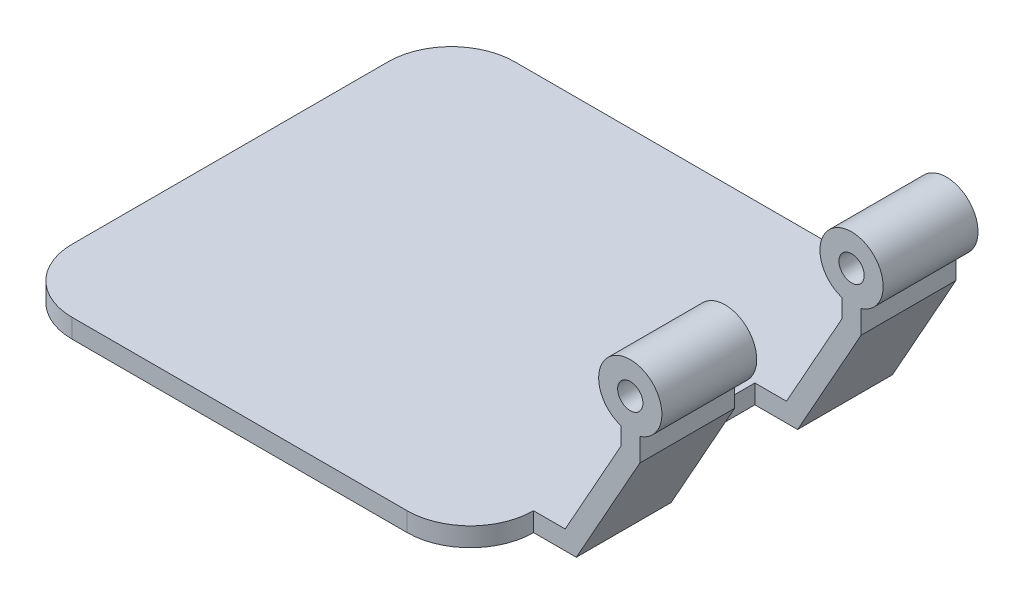
from build123d import *

# Parameters (mm, degrees)
SKETCH1_R               = 5
BOSS_EXTRUDE1_DEPTH     = 50
SKETCH2_R               = 2
CUT_EXTRUDE1_DEPTH      = 113.087037288
CUT_EXTRUDE3_DEPTH      = 10
CUT_EXTRUDE3_DEPTH_BACK = 10
SKETCH7_W               = 20
SKETCH7_H               = 39.987182744
BOSS_EXTRUDE2_REACH     = 114.087
CUT_EXTRUDE4_REACH      = 114.087
SKETCH9_W               = 20
SKETCH9_H               = 10.896319728
CUT_EXTRUDE6_REACH      = 114.087
SKETCH11_W              = 5
SKETCH11_H              = 3
SKETCH12_W              = 73
SKETCH12_H              = 70
BOSS_EXTRUDE3_DEPTH     = 3
SKETCH13_W              = 6.758772051
SKETCH13_H              = 20
CUT_EXTRUDE7_DEPTH      = 117.122297969
FILLET1_R               = 10


with BuildPart() as part:
    # Sketch1 → Boss-Extrude1 (new body)
    with BuildSketch(Plane.XY):
        with Locations((90.291740814, 26.352640412)):
            Circle(SKETCH1_R)
        Polygon((0, 3), (0, 0), (81.758772051, 0), (91.791740814, 17.924366601), (91.791740814, 23.706854983), (88.791740814, 23.706854983), (88.791740814, 18.706854983), (80, 3), align=None)
    extrude(amount=BOSS_EXTRUDE1_DEPTH)

    # Sketch2 → Cut-Extrude1 (cut, through all)
    with BuildSketch(Plane.XY):
        with Locations((90.291740814, 26.352640412)):
            Circle(SKETCH2_R)
    extrude(amount=CUT_EXTRUDE1_DEPTH, mode=Mode.SUBTRACT)

    # Sketch7 → Cut-Extrude3 (cut, two sides: drawn at the far end of the back side and taken through both)
    with BuildSketch(Plane(origin=(62.254079791, -34.846042362, 0), x_dir=(0, 0, -1), z_dir=(0.8726030546274219, -0.4884300452008377, 0)).offset(-CUT_EXTRUDE3_DEPTH_BACK)):
        with Locations((-25, 59.927032101)):
            Rectangle(SKETCH7_W, SKETCH7_H)
    extrude(amount=CUT_EXTRUDE3_DEPTH + CUT_EXTRUDE3_DEPTH_BACK, mode=Mode.SUBTRACT)

    # Sketch8 → Boss-Extrude2 (add, up to next)
    with BuildSketch(Plane.XY, mode=Mode.PRIVATE) as boss_extrude2_sk1:
        Polygon((66.951015515, 3), (66.951015515, 0), (81.758772051, 0), (79.25400484, 1.667244856), (80, 3), align=None)
    boss_extrude2_tool1 = extrude(boss_extrude2_sk1.sketch, amount=BOSS_EXTRUDE2_REACH, mode=Mode.PRIVATE) - part.part
    add(boss_extrude2_tool1.solids().sort_by_distance((73.552437, 1.463367, 0))[0])

    # Sketch9 → Cut-Extrude4 (cut, up to next)
    with BuildSketch(Plane(origin=(0, 0, 0), x_dir=(0, 0, -1), z_dir=(1, 0, 0)), mode=Mode.PRIVATE) as cut_extrude4_sk1:
        with Locations((-25, 32.01270193)):
            Rectangle(SKETCH9_W, SKETCH9_H)
    cut_extrude4_tool1 = extrude(cut_extrude4_sk1.sketch, amount=CUT_EXTRUDE4_REACH, mode=Mode.PRIVATE) & part.part
    add(cut_extrude4_tool1.solids().sort_by_distance((0, 32.012702, 25))[0], mode=Mode.SUBTRACT)

    # Sketch11 → Cut-Extrude6 (cut, up to next)
    with BuildSketch(Plane.XY.offset(50), mode=Mode.PRIVATE) as cut_extrude6_sk1:
        with Locations((2.5, 1.5)):
            Rectangle(SKETCH11_W, SKETCH11_H)
    cut_extrude6_tool1 = extrude(cut_extrude6_sk1.sketch, amount=-CUT_EXTRUDE6_REACH, mode=Mode.PRIVATE) & part.part
    add(cut_extrude6_tool1.solids().sort_by_distance((2.5, 1.5, 50))[0], mode=Mode.SUBTRACT)

    # Sketch12 → Boss-Extrude3 (add, through all)
    with BuildSketch(Plane(origin=(0, 3, 0), x_dir=(1, 0, 0), z_dir=(0, 1, 0))):
        with Locations((38.5, -25)):
            Rectangle(SKETCH12_W, SKETCH12_H)
    extrude(amount=-BOSS_EXTRUDE3_DEPTH)

    # Sketch13 → Cut-Extrude7 (cut, through all)
    with BuildSketch(Plane(origin=(0, 3, 0), x_dir=(1, 0, 0), z_dir=(0, 1, 0))):
        with Locations((78.379386025, -25)):
            Rectangle(SKETCH13_W, SKETCH13_H)
    extrude(amount=-CUT_EXTRUDE7_DEPTH, mode=Mode.SUBTRACT)

    # Fillet1
    fillet1_edges = [part.edges().sort_by_distance(p)[0] for p in [
        (75, 1.5, -10),
        (2, 1.5, -10),
        (2, 1.5, 60),
        (75, 1.5, 60),
    ]]
    fillet(fillet1_edges, radius=FILLET1_R - 0.0001)  # a hair under: the kernel refuses the full size


solid = part.part
